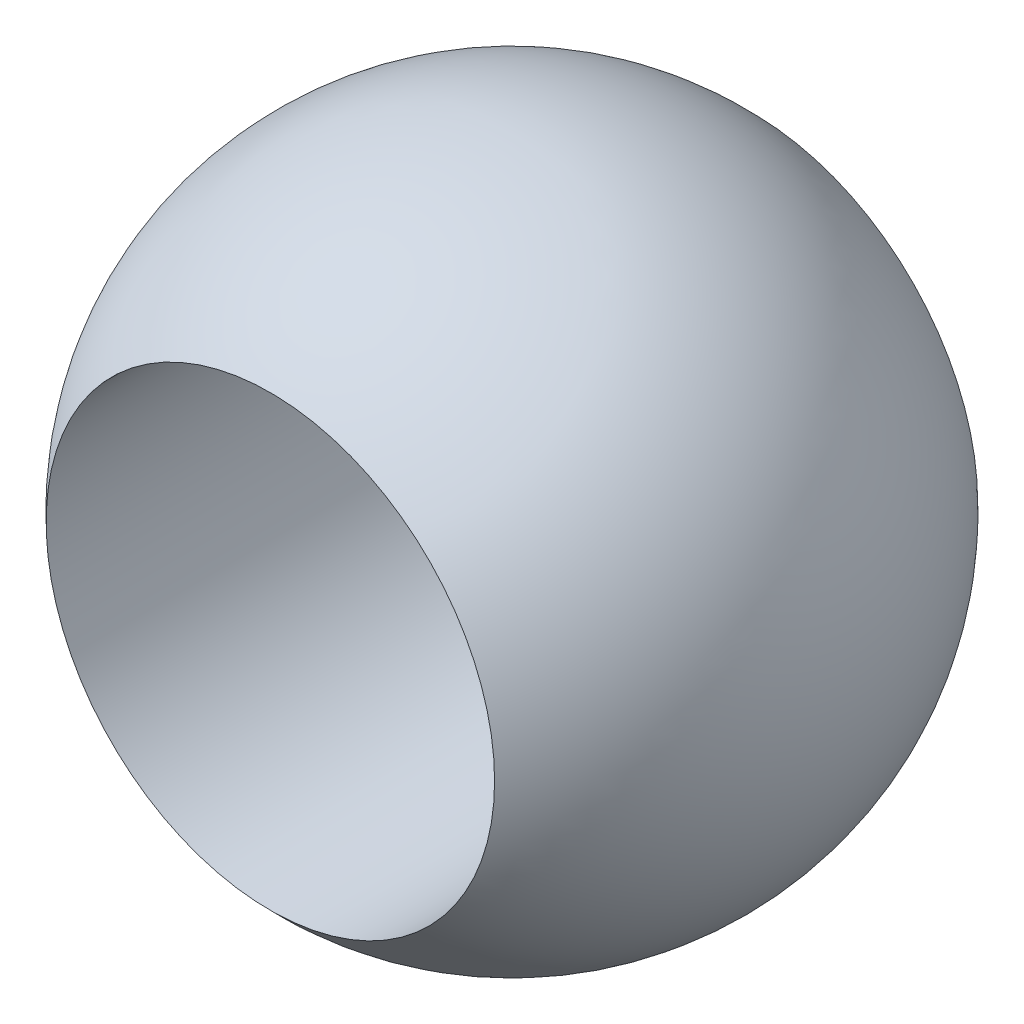
from build123d import *

# Parameters (mm, degrees)
CUT_EXTRUDE1_DEPTH      = 13.124355653
CUT_EXTRUDE1_DEPTH_BACK = 13.124355653
SKETCH2_R               = 4.7625


with BuildPart() as part:
    # Sketch1 → Revolve1 (revolve)
    with BuildSketch(Plane(origin=(0, 0, 0), x_dir=(1, 0, 0), z_dir=(0, 1, 0))):
        with BuildLine():
            Line((0, 7), (0, -7))
            ThreePointArc((0, -7), (-7, 0), (0, 7))
        make_face()
    revolve(axis=Axis((0, 0, -7), (0, 0, 1)))

    # Sketch2 → Cut-Extrude1 (cut, two sides: drawn at the far end of the back side and taken through both)
    with BuildSketch(Plane.XY.offset(-CUT_EXTRUDE1_DEPTH_BACK)):
        Circle(SKETCH2_R)
    extrude(amount=CUT_EXTRUDE1_DEPTH + CUT_EXTRUDE1_DEPTH_BACK, mode=Mode.SUBTRACT)


solid = part.part
